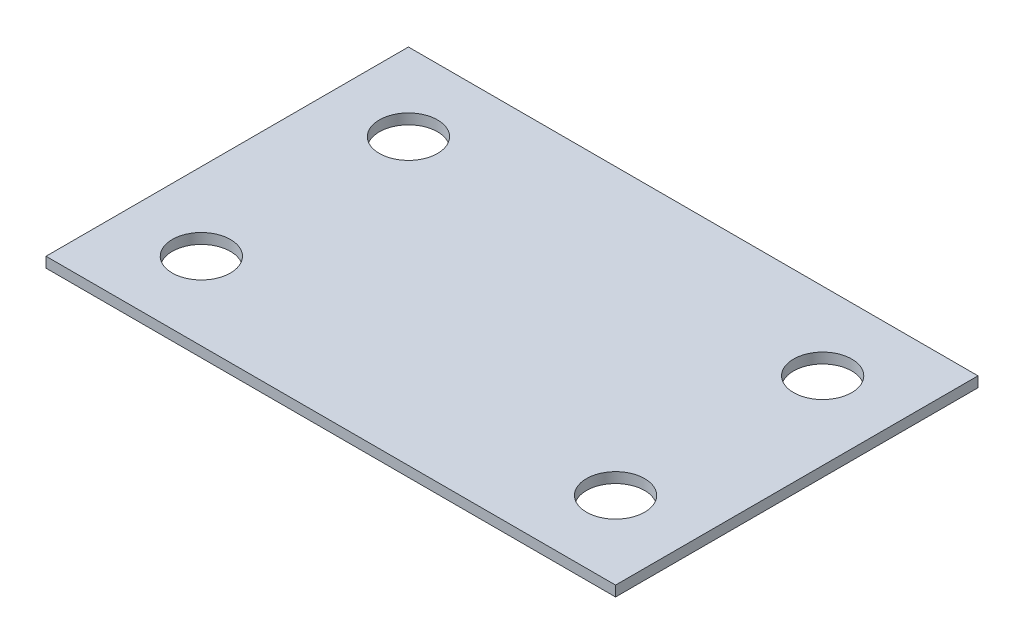
from build123d import *

# Parameters (mm, degrees)
SKETCH1_W           = 69.85
SKETCH1_H           = 44.45
SKETCH1_R           = 3.5687
BOSS_EXTRUDE1_DEPTH = 1.27


with BuildPart() as part:
    # Sketch1 → Boss-Extrude1 (new body)
    with BuildSketch(Plane(origin=(0, 0, 0), x_dir=(1, 0, 0), z_dir=(0, 1, 0))):
        with Locations((34.925, 22.225)):
            Rectangle(SKETCH1_W, SKETCH1_H)
        with Locations((9.525, 34.925)):
            Circle(SKETCH1_R, mode=Mode.SUBTRACT)
        with Locations((60.325, 34.925)):
            Circle(SKETCH1_R, mode=Mode.SUBTRACT)
        with Locations((9.525, 9.525)):
            Circle(SKETCH1_R, mode=Mode.SUBTRACT)
        with Locations((60.325, 9.525)):
            Circle(SKETCH1_R, mode=Mode.SUBTRACT)
    extrude(amount=BOSS_EXTRUDE1_DEPTH)


solid = part.part
